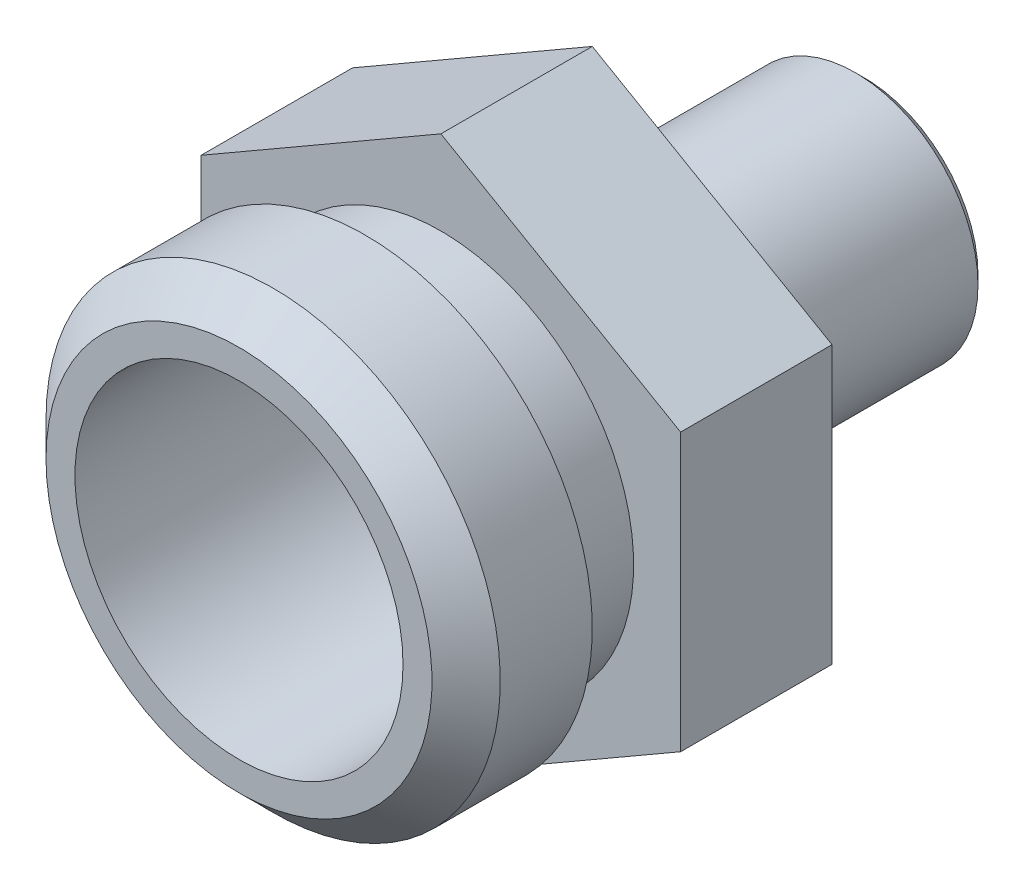
from build123d import *

# Parameters (mm, degrees)
SKETCH_1_R          = 9
EXTRUDE_1_DEPTH     = 8
SKETCH_3_R          = 6.5
EXTRUDE_2_DEPTH     = 8
EXTRUDE_3_DEPTH     = 6
SKETCH_5_R          = 6.5
EXTRUDE_4_DEPTH     = 11
SKETCH_8_R          = 6.5
CUT_EXTRUDE_3_DEPTH = 11
SKETCH_9_W          = 1.361349768
SKETCH_9_H          = 3
SKETCH_10_R         = 4.5
CUT_EXTRUDE_4_DEPTH = 29.906458333


# Read off the part's stored shape, not the designer's step: M18 机械螺纹 螺柱1, G1/8 直管螺纹 螺柱1
with BuildPart() as part:
    # 草图1 → 凸台-拉伸1 (new body)
    with BuildSketch(Plane.XY):
        Circle(SKETCH_1_R)
    extrude(amount=-EXTRUDE_1_DEPTH)

    # 草图3 → 凸台-拉伸2 (add)
    with BuildSketch(Plane.XY):
        Circle(SKETCH_3_R)
    extrude(amount=-EXTRUDE_2_DEPTH)

    # 草图4 → 凸台-拉伸3 (add)
    with BuildSketch(Plane(origin=(0, 0, -8), x_dir=(-1, 0, 0), z_dir=(0, 0, -1))):
        Polygon((0, 10.969655115), (-9.5, 5.484827557), (-9.5, -5.484827557), (0, -10.969655115), (9.5, -5.484827557), (9.5, 5.484827557), align=None)
    extrude(amount=EXTRUDE_3_DEPTH)

    # 草图5 → 凸台-拉伸4 (add)
    with BuildSketch(Plane(origin=(0, 0, -14), x_dir=(-1, 0, 0), z_dir=(0, 0, -1))):
        with Locations(Location((0, 0, 0), (0, 0, 180))):
            Circle(SKETCH_5_R)
    extrude(amount=EXTRUDE_4_DEPTH)

    # M18 机械螺纹 螺柱1 outline → M18 机械螺纹 螺柱1 (revolve, cut)
    with BuildSketch(Plane.XZ):
        Polygon((9, 0), (7.647, 0), (9, -1.353), align=None)
    revolve(axis=Axis((0, 0, 0), (0, 0, 1)), mode=Mode.SUBTRACT)

    # G1/8 直管螺纹 螺柱1 outline → G1/8 直管螺纹 螺柱1 (revolve, cut)
    with BuildSketch(Plane.XZ):
        Polygon((6.5, -14), (4.864, -14), (4.864, -24.419), (4.283, -25), (6.5, -25), align=None)
    revolve(axis=Axis((0, 0, 0), (0, 0, 1)), mode=Mode.SUBTRACT)

    # 草图8 → 切除-拉伸3 (cut)
    with BuildSketch(Plane.XY):
        Circle(SKETCH_8_R)
    extrude(amount=-CUT_EXTRUDE_3_DEPTH, mode=Mode.SUBTRACT)

    # 草图9 → 切除-旋转1 (revolve, cut)
    with BuildSketch(Plane(origin=(0, 0, 0), x_dir=(1, 0, 0), z_dir=(0, 1, 0)), mode=Mode.PRIVATE) as cut_revolve_1_sk:
        with Locations((8.319325116, 6.5)):
            Rectangle(SKETCH_9_W, SKETCH_9_H)
    revolve(cut_revolve_1_sk.sketch.rotate(Axis((0, 0, -7.326856085), (0, 0, 1)), 180), axis=Axis((0, 0, -7.326856085), (0, 0, 1)), mode=Mode.SUBTRACT)

    # 草图10 → 切除-拉伸4 (cut, through all)
    with BuildSketch(Plane(origin=(0, 0, -25), x_dir=(-1, 0, 0), z_dir=(0, 0, -1))):
        with Locations(Location((0, 0, 0), (0, 0, 180))):
            Circle(SKETCH_10_R)
    extrude(amount=-CUT_EXTRUDE_4_DEPTH, mode=Mode.SUBTRACT)


solid = part.part
